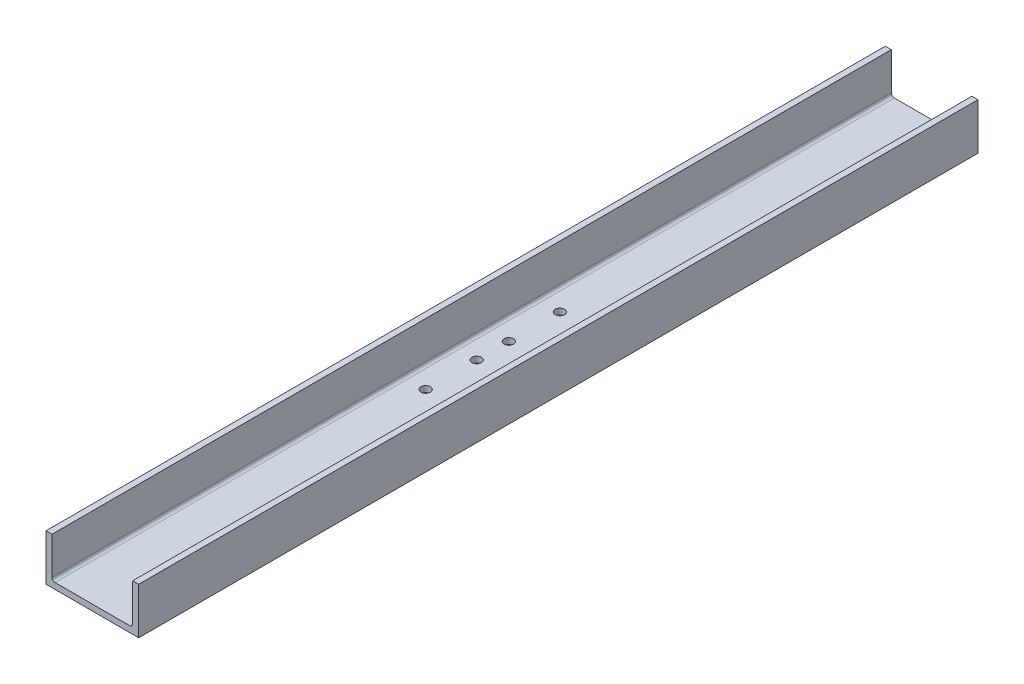
from build123d import *

# Parameters (mm, degrees)
BOSS_EXTRUDE1_DEPTH = 230
FILLET1_R           = 1.651
SKETCH4_R           = 2.585
CUT_EXTRUDE1_DEPTH  = 10


with BuildPart() as part:
    # Sketch3 → Boss-Extrude1 (new, symmetric)
    with BuildSketch(Plane.XY):
        Polygon((-25.4, 12.7), (-25.4, -12.7), (25.4, -12.7), (25.4, 12.7), (22.098, 12.7), (22.098, -9.398), (-22.098, -9.398), (-22.098, 12.7), align=None)
    extrude(amount=BOSS_EXTRUDE1_DEPTH, both=True)

    # Fillet1
    fillet1_edges = [part.edges().sort_by_distance(p)[0] for p in [
        (22.098, -9.398, 0),
        (-22.098, -9.398, 0),
    ]]
    fillet(fillet1_edges, radius=FILLET1_R)

    # Sketch4 → Cut-Extrude1 (cut)
    with BuildSketch(Plane(origin=(0, -9.398, 0), x_dir=(1, 0, 0), z_dir=(0, 1, 0))):
        with Locations((-10.530435142, 8.79)):
            Circle(SKETCH4_R)
        with Locations((10.469564858, 8.79)):
            Circle(SKETCH4_R)
        with Locations((-10.530435142, 36.79)):
            Circle(SKETCH4_R)
        with Locations((10.469564858, 36.79)):
            Circle(SKETCH4_R)
        with Locations((-10.530435142, -36.79)):
            Circle(SKETCH4_R)
        with Locations((10.469564858, -36.79)):
            Circle(SKETCH4_R)
        with Locations((10.469564858, -8.79)):
            Circle(SKETCH4_R)
        with Locations((-10.530435142, -8.79)):
            Circle(SKETCH4_R)
    extrude(amount=-CUT_EXTRUDE1_DEPTH, mode=Mode.SUBTRACT)


solid = part.part
